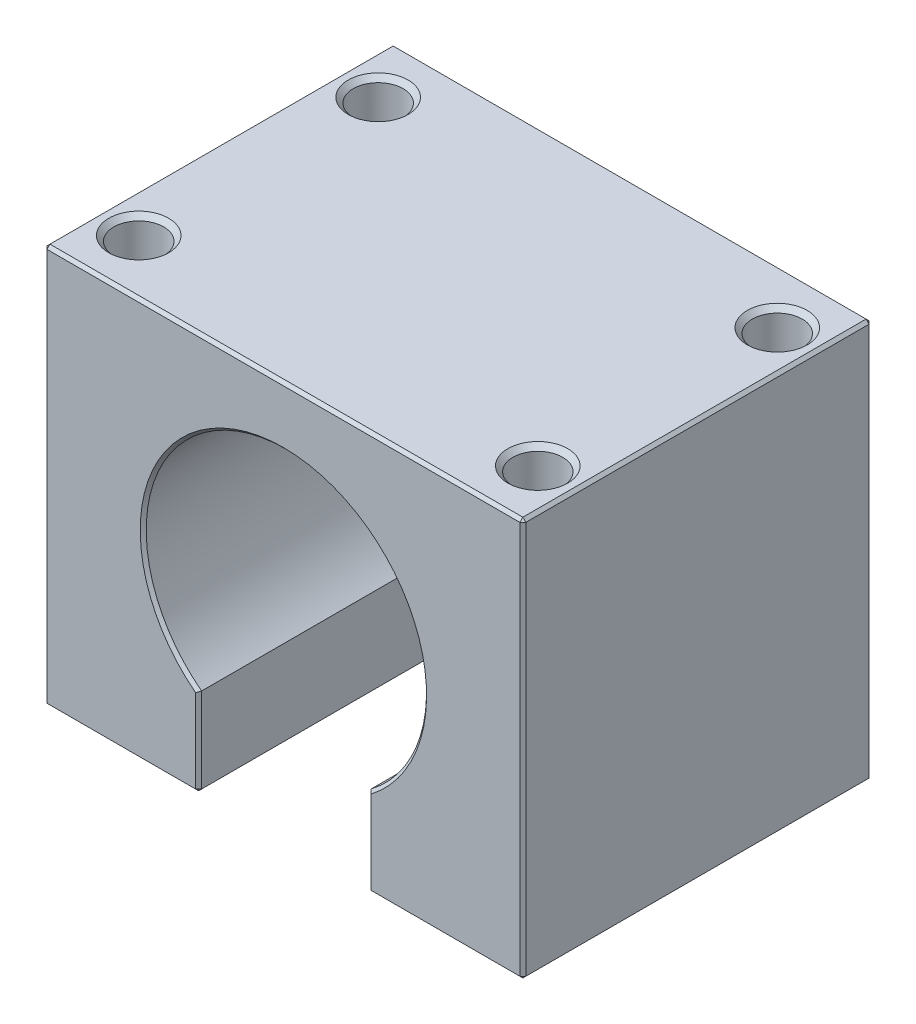
from build123d import *

# Parameters (mm, degrees)
BOSS_EXTRUDE1_DEPTH = 35
CHAMFER2_SIZE       = 0.3
SKETCH2_R           = 2.5
CUT_EXTRUDE1_DEPTH  = 17
SKETCH3_R           = 2.5
CUT_EXTRUDE2_DEPTH  = 20
CHAMFER3_SIZE       = 0.5


with BuildPart() as part:
    # Sketch1 → Boss-Extrude1 (new body)
    with BuildSketch(Plane.XY):
        with BuildLine():
            Line((24, 0), (-24, 0))
            Line((-24, 0), (-24, -40))
            Line((-24, -40), (-8.5, -40))
            Line((-8.5, -40), (-8.5, -31.187157816))
            ThreePointArc((-8.5, -31.187157816), (0, -5.95), (8.5, -31.187157816))
            Line((8.5, -31.187157816), (8.5, -40))
            Line((8.5, -40), (24, -40))
            Line((24, -40), (24, 0))
        make_face()
    extrude(amount=BOSS_EXTRUDE1_DEPTH)

    # Chamfer2
    chamfer2_edges = [part.edges().sort_by_distance(p)[0] for p in [
        (-8.5, -35.593578908, 0),
        (-16.25, -40, 0),
        (16.25, -40, 0),
        (8.5, -35.593578908, 0),
        (-24, -20, 0),
        (-24, -40, 17.5),
        (8.5, -40, 17.5),
        (0, 0, 0),
        (-24, 0, 17.5),
        (-8.5, -40, 17.5),
        (-8.5, -35.593578908, 35),
        (-16.25, -40, 35),
        (-24, -20, 35),
        (8.5, -35.593578908, 35),
        (16.25, -40, 35),
        (24, -40, 17.5),
        (24, -20, 0),
        (24, 0, 17.5),
        (0, 0, 35),
        (24, -20, 35),
        (0, -5.95, 35),
        (0, -5.95, 0),
    ]]
    chamfer(chamfer2_edges, length=CHAMFER2_SIZE)

    # Sketch2 → Cut-Extrude1 (cut)
    with BuildSketch(Plane(origin=(0, 0, 0), x_dir=(1, 0, 0), z_dir=(0, 1, 0))):
        with Locations((-20, -5.5)):
            Circle(SKETCH2_R)
        with Locations((20, -5.5)):
            Circle(SKETCH2_R)
        with Locations((20, -29.5)):
            Circle(SKETCH2_R)
        with Locations((-20, -29.5)):
            Circle(SKETCH2_R)
    extrude(amount=-CUT_EXTRUDE1_DEPTH, mode=Mode.SUBTRACT)

    # Sketch3 → Cut-Extrude2 (cut)
    with BuildSketch(Plane(origin=(0, 0, 0), x_dir=(-1, 0, 0), z_dir=(0, 0, -1))):
        with Locations((-13.435028843, -33.435028843)):
            Circle(SKETCH3_R)
        with Locations((13.435028843, -33.435028843)):
            Circle(SKETCH3_R)
        with Locations((13.435028843, -6.564971157)):
            Circle(SKETCH3_R)
        with Locations((-13.435028843, -6.564971157)):
            Circle(SKETCH3_R)
        with Locations((-19, -20)):
            Circle(SKETCH3_R)
        with Locations((19, -20)):
            Circle(SKETCH3_R)
    extrude(amount=-CUT_EXTRUDE2_DEPTH, mode=Mode.SUBTRACT)

    # Chamfer3
    chamfer3_edges = [part.edges().sort_by_distance(p)[0] for p in [
        (21.5, -20, 0),
        (15.935028843, -33.435028843, 0),
        (-10.935028843, -33.435028843, 0),
        (-16.5, -20, 0),
        (-10.935028843, -6.564971157, 0),
        (17.5, 0, 29.5),
        (17.5, 0, 5.5),
        (-22.5, 0, 29.5),
        (-22.5, 0, 5.5),
    ]]
    chamfer(chamfer3_edges, length=CHAMFER3_SIZE)


solid = part.part
